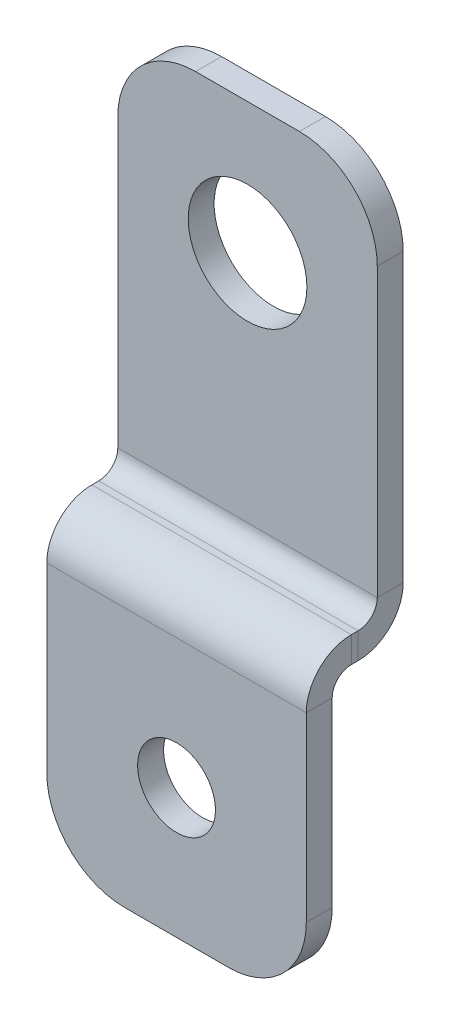
from build123d import *

# Parameters (mm, degrees)
SKETCH1_W          = 10
SKETCH1_H          = 14.057527786
SKETCH1_R          = 2.287307526
BASE_FLANGE1_DEPTH = 1
EDGE_FLANGE1_DEPTH = 10
EDGE_FLANGE2_DEPTH = 10
SKETCH12_R         = 1.5
CUT_EXTRUDE1_DEPTH = 2
FILLET1_R          = 3


# Sheet-metal steps are written as plain solids
with BuildPart() as part:
    # Sketch1 → Base-Flange1 (new body)
    with BuildSketch(Plane.XY):
        with Locations((-509.974194853, -21.379047402)):
            Rectangle(SKETCH1_W, SKETCH1_H)
        with Locations((-509.974194853, -19.4)):
            Circle(SKETCH1_R, mode=Mode.SUBTRACT)
    extrude(amount=BASE_FLANGE1_DEPTH)

    # Edge-Flange1 section (across the edge) → Edge-Flange1 (add)
    with BuildSketch(Plane(origin=(-514.974194853, -29.144411295, 1), x_dir=(0, 1, 0), z_dir=(1, 0, 0))):
        with BuildLine():
            Line((-1, 0.7366), (-1, 1))
            Line((-1, 1), (0, 1))
            Line((0, 1), (0, 0.7366))
            ThreePointArc((0, 0.7366), (0.215745145, 0.215745145), (0.7366, 0))
            Line((0.7366, 0), (0.7366, -1))
            ThreePointArc((0.7366, -1), (-0.491361636, -0.491361636), (-1, 0.7366))
        make_face()
    extrude(amount=EDGE_FLANGE1_DEPTH)

    # Edge-Flange2 section (across the edge) → Edge-Flange2 (add)
    with BuildSketch(Plane(origin=(-504.974194853, -30.144411295, 2.7366), x_dir=(0, 0, -1), z_dir=(-1, 0, 0))):
        with BuildLine():
            Line((-1, 0.7366), (-1, 10.7366))
            Line((-1, 10.7366), (0, 10.7366))
            Line((0, 10.7366), (0, 0.7366))
            ThreePointArc((0, 0.7366), (0.215745145, 0.215745145), (0.7366, 0))
            Line((0.7366, 0), (0.7366, -1))
            ThreePointArc((0.7366, -1), (-0.491361636, -0.491361636), (-1, 0.7366))
        make_face()
    extrude(amount=EDGE_FLANGE2_DEPTH)

    # Sketch12 → Cut-Extrude1 (cut)
    with BuildSketch(Plane(origin=(0, 0, 2.7366), x_dir=(-1, 0, 0), z_dir=(0, 0, -1))):
        with Locations((509.974194853, -35.881011295)):
            Circle(SKETCH12_R)
    extrude(amount=-CUT_EXTRUDE1_DEPTH, mode=Mode.SUBTRACT)

    # Fillet1
    fillet1_edges = [part.edges().sort_by_distance(p)[0] for p in [
        (-504.974194853, -40.881011295, 3.2366),
        (-514.974194853, -40.881011295, 3.2366),
        (-514.974194853, -14.350283509, 0.5),
        (-504.974194853, -14.350283509, 0.5),
    ]]
    fillet(fillet1_edges, radius=FILLET1_R)


solid = part.part
